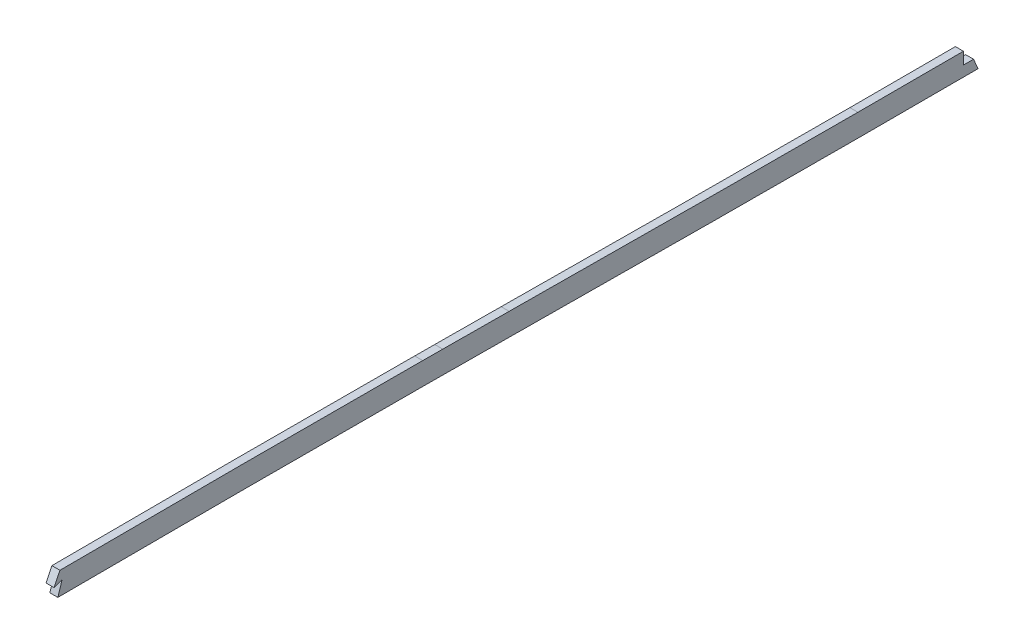
from build123d import *

# Parameters (mm, degrees)
BOSS_EXTRUDE1_START = -1.5875
BOSS_EXTRUDE1_DEPTH = 3.175
FILLET1_R           = 2.54
CUT_EXTRUDE1_DEPTH  = 2674.191025632
FILLET2_R           = 0.762
FILLET3_R           = 0.762
CUT_EXTRUDE2_DEPTH  = 7.62


with BuildPart() as part:
    # Boss-Extrude1: read off the stored shape, not the designer's step
    # Boss-Extrude1 outline → Boss-Extrude1 (new body)
    with BuildSketch(Plane(origin=(0, 0, 0), x_dir=(0, 0, -1), z_dir=(1, 0, 0)).offset(BOSS_EXTRUDE1_START)):
        with BuildLine():
            add(Edge.make_bspline(
                [(1110.404970926, 130.384545774), (1120.170834465, 130.370061323), (1139.703057908, 130.338772026), (1168.998370974, 130.277673039), (1198.290610395, 130.194386876), (1217.81419633, 130.113940836), (1227.576506903, 130.06508052)],
                knots=[0, 0, 0, 0, 0.25, 0.5, 0.75, 1, 1, 1, 1], degree=3))
            add(Edge.make_bspline(
                [(1227.576506903, 130.06508052), (1269.911205773, 129.853195249), (1333.427746701, 129.273373321), (1418.042208161, 127.449050563), (1502.665994832, 124.913583682), (1608.454176987, 120.803299479), (1693.070073331, 116.848243245), (1735.369787733, 114.744712179)],
                knots=[0, 0, 0, 0, 0.25, 0.375, 0.5, 0.75, 1, 1, 1, 1], degree=3))
            add(Edge.make_bspline(
                [(1735.369787733, 114.744712179), (1815.995940723, 110.735232018), (1936.906650462, 104.096364548), (2098.049485168, 94.18797875), (2198.694736725, 87.314638509), (2279.130413747, 81.114418931), (2339.412950304, 76.034076608), (2399.564054334, 70.28270545), (2479.570468264, 61.127378254), (2559.292087872, 49.650907614), (2626.797554585, 38.235484735), (2656.889518578, 32.788503969), (2667.159793662, 30.877771266), (2669.54, 30.432069924)],
                knots=[0, 0, 0, 0, 0.25, 0.375, 0.5, 0.5625, 0.625, 0.6875, 0.75, 0.875, 0.9375, 0.96241067, 0.969928536, 0.969928536, 0.969928536, 0.969928536], degree=3))
            Line((2669.54, 30.432069924), (2669.54, 39.476142465))
            add(Edge.make_bspline(
                [(1735.811334709, 123.623740069), (1776.138635499, 121.618292624), (1816.460281579, 119.500621806), (1897.093668675, 115.087561885), (1937.405638896, 112.792971084), (2018.018419045, 108.018366523), (2058.319512223, 105.539122976), (2138.903780144, 100.307240032), (2179.18739793, 97.555127955), (2239.586998714, 93.080168687), (2259.716280977, 91.529837622), (2289.900442602, 89.09084343), (2299.960179135, 88.258845039), (2320.076004566, 86.552861654), (2330.132100898, 85.678962223), (2350.239356518, 83.874334847), (2360.290489794, 82.943307484), (2380.385973971, 81.003183297), (2390.430065378, 79.993418555), (2420.547026195, 76.827577532), (2440.60648589, 74.533672955), (2480.675569568, 69.556278523), (2500.68715183, 66.874150811), (2540.654290207, 61.150246295), (2560.611026428, 58.109755646), (2600.475457131, 51.702465574), (2620.382967089, 48.337538888), (2650.028116889, 43.072156367), (2659.78844051, 41.29687683), (2669.54, 39.476142465)],
                knots=[0, 0, 0, 0, 0.125, 0.125, 0.25, 0.25, 0.375, 0.375, 0.5, 0.5, 0.5625, 0.5625, 0.59375, 0.59375, 0.625, 0.625, 0.65625, 0.65625, 0.6875, 0.6875, 0.75, 0.75, 0.8125, 0.8125, 0.875, 0.875, 0.9375, 0.9375, 0.968210768, 0.968210768, 0.968210768, 0.968210768], degree=3))
            add(Edge.make_bspline(
                [(1227.621000751, 138.954969175), (1248.807303679, 138.848931677), (1269.993583155, 138.701170252), (1312.363832348, 138.270664618), (1333.547719008, 137.987407832), (1375.912368189, 137.249274813), (1397.09309738, 136.7925677), (1439.451328259, 135.701855835), (1460.629010312, 135.069210584), (1502.979101161, 133.670541385), (1524.152152736, 132.907434339), (1566.494303759, 131.284732459), (1587.663166024, 130.423163385), (1651.164052809, 127.709123983), (1693.490421561, 125.728325331), (1735.811334709, 123.623740069)],
                knots=[0, 0, 0, 0, 0.125, 0.125, 0.25, 0.25, 0.375, 0.375, 0.5, 0.5, 0.625, 0.625, 0.75, 0.75, 1, 1, 1, 1], degree=3))
            add(Edge.make_bspline(
                [(1110.418156307, 139.274535996), (1129.952027249, 139.245563914), (1149.485893504, 139.211997476), (1188.553558893, 139.115899087), (1208.087346834, 139.052735015), (1227.621000751, 138.954969175)],
                knots=[0, 0, 0, 0, 0.5, 0.5, 1, 1, 1, 1], degree=3))
            add(Edge.make_bspline(
                [(768.740124165, 138.468408213), (782.976796045, 138.460280143), (797.213453801, 138.479500079), (825.686695051, 138.549690296), (839.923258916, 138.600062665), (868.396318956, 138.719026333), (882.632808962, 138.789607972), (911.105746117, 138.939594729), (925.342197007, 139.018479563), (953.81517223, 139.160090703), (968.051699178, 139.222241505), (996.524919377, 139.30995407), (1010.761605517, 139.335014039), (1039.234912871, 139.349647552), (1053.471562869, 139.340493535), (1081.944860968, 139.313691902), (1096.181508981, 139.29565137), (1110.418156307, 139.274535996)],
                knots=[0, 0, 0, 0, 0.125, 0.125, 0.25, 0.25, 0.375, 0.375, 0.5, 0.5, 0.625, 0.625, 0.75, 0.75, 0.875, 0.875, 1, 1, 1, 1], degree=3))
            add(Edge.make_bspline(
                [(630.778432202, 139.251437536), (653.771819614, 139.075315664), (676.765000849, 138.871740519), (711.255349111, 138.647690701), (722.752238945, 138.586174182), (745.746099074, 138.499784896), (757.243084259, 138.474972158), (768.740124165, 138.468408213)],
                knots=[0, 0, 0, 0, 0.5, 0.5, 0.75, 0.75, 1, 1, 1, 1], degree=3))
            add(Edge.make_bspline(
                [(604.514984259, 139.433685568), (609.940743136, 139.400696354), (618.695242427, 139.342071397), (627.449694696, 139.276935028), (630.778432202, 139.251437536)],
                knots=[0, 0, 0, 0, 0.619765686, 1, 1, 1, 1], degree=3))
            ThreePointArc((604.514984259, 139.433685568), (600.549356142, 139.457173081), (596.583720644, 139.479379304))
            add(Edge.make_bspline(
                [(436.133018826, 139.357176562), (449.50393779, 139.390650739), (462.874888934, 139.412366015), (489.61665939, 139.498555977), (502.987497127, 139.559076553), (529.729299233, 139.628029754), (543.100240501, 139.639230481), (569.84212102, 139.601013959), (583.212960696, 139.552035302), (596.583720644, 139.479379304)],
                knots=[0, 0, 0, 0, 0.25, 0.25, 0.5, 0.5, 0.75, 0.75, 1, 1, 1, 1], degree=3))
            add(Edge.make_bspline(
                [(432.263917423, 139.347117104), (433.553617637, 139.350567112), (434.843318039, 139.353947814), (436.133018826, 139.357176562)],
                knots=[0, 0, 0, 0, 1, 1, 1, 1], degree=3))
            add(Edge.make_bspline(
                [(420.316232014, 139.305761868), (422.413235913, 139.315186344), (426.395793967, 139.330351666), (430.378363115, 139.342073082), (432.263917423, 139.347117104)],
                knots=[0, 0, 0, 0, 0.526548575, 1, 1, 1, 1], degree=3))
            add(Edge.make_bspline(
                [(376.410119779, 138.75403864), (383.726317086, 138.935561778), (391.043801196, 139.055611797), (405.679602634, 139.224192856), (412.997895507, 139.272871444), (420.316232014, 139.305761868)],
                knots=[0, 0, 0, 0, 0.5, 0.5, 1, 1, 1, 1], degree=3))
            add(Edge.make_bspline(
                [(336.49221538, 137.002990798), (349.782924989, 137.88646357), (363.094318653, 138.423658969), (376.410119779, 138.75403864)],
                knots=[0, 0, 0, 0, 1, 1, 1, 1], degree=3))
            add(Edge.make_bspline(
                [(322.369488076, 135.928469458), (327.073374868, 136.333386449), (331.781331813, 136.689844531), (336.49221538, 137.002990798)],
                knots=[0, 0, 0, 0, 1, 1, 1, 1], degree=3))
            add(Edge.make_bspline(
                [(269.769949315, 129.47895505), (274.123387467, 130.231879276), (278.485668028, 130.925946417), (287.22796256, 132.196043087), (291.608626646, 132.771988738), (300.381777496, 133.818422146), (304.774579419, 134.288963443), (313.567800313, 135.154375086), (317.967903853, 135.549407043), (322.369488076, 135.928469458)],
                knots=[0, 0, 0, 0, 0.25, 0.25, 0.5, 0.5, 0.75, 0.75, 1, 1, 1, 1], degree=3))
            add(Edge.make_bspline(
                [(135.15718457, 90.054634926), (146.043739673, 94.375230064), (156.99891695, 98.504335222), (173.56622243, 104.322560697), (179.110932848, 106.199810145), (190.24859245, 109.819698901), (195.841545849, 111.562316625), (207.065472514, 114.901345648), (212.697969124, 116.49836249), (224.005973618, 119.540534541), (229.683240596, 120.9862349), (246.767187276, 125.077694043), (258.225188059, 127.482295924), (269.769949315, 129.47895505)],
                knots=[0, 0, 0, 0, 0.25, 0.25, 0.375, 0.375, 0.5, 0.5, 0.625, 0.625, 0.75, 0.75, 1, 1, 1, 1], degree=3))
            add(Edge.make_bspline(
                [(107.049744533, 78.466050261), (116.373258882, 82.438606419), (125.737350123, 86.316143859), (135.15718457, 90.054634926)],
                knots=[0, 0, 0, 0, 1, 1, 1, 1], degree=3))
            add(Edge.make_bspline(
                [(99.06, 75.03568963), (99.223542669, 75.106424562), (100.635498802, 75.716852689), (103.297453866, 76.863328103), (105.798503999, 77.932922637), (107.049744533, 78.466050261)],
                knots=[0.484151133, 0.484151133, 0.484151133, 0.484151133, 0.515864471, 0.757931449, 1, 1, 1, 1], degree=3))
            Line((99.06, 75.03568963), (99.06, 65.345043949))
            add(Edge.make_bspline(
                [(99.06, 65.345043949), (99.380370965, 65.484464523), (100.637671455, 66.031176319), (103.17753745, 67.132002814), (106.681577323, 68.64166857), (109.249580285, 69.740028797), (110.534459652, 70.287489229)],
                knots=[0.254738807, 0.254738807, 0.254738807, 0.254738807, 0.317238807, 0.5, 0.75, 1, 1, 1, 1], degree=3))
            add(Edge.make_bspline(
                [(110.534459652, 70.287489229), (112.850658013, 71.274373329), (117.489277519, 73.236837099), (124.456688526, 76.138068453), (131.438476528, 78.994265342), (136.101204469, 80.864754132), (138.436571012, 81.791601309)],
                knots=[0, 0, 0, 0, 0.25, 0.5, 0.75, 1, 1, 1, 1], degree=3))
            add(Edge.make_bspline(
                [(138.436571012, 81.791601309), (143.826897197, 83.930883835), (154.6522834, 88.11877139), (176.408203186, 96.037596764), (203.906835742, 104.998187521), (237.39469787, 114.027149543), (259.934818065, 118.755998441), (271.284977744, 120.719001348)],
                knots=[0, 0, 0, 0, 0.125, 0.25, 0.5, 0.75, 1, 1, 1, 1], degree=3))
            add(Edge.make_bspline(
                [(271.284977744, 120.719001348), (275.558711595, 121.458140765), (284.124297478, 122.821139095), (297.036360548, 124.518896272), (310.018420247, 125.909880891), (318.766623126, 126.695286194), (323.13209925, 127.071239405)],
                knots=[5e-09, 5e-09, 5e-09, 5e-09, 0.2499992, 0.4999984, 0.7499976, 0.999996801, 0.999996801, 0.999996801, 0.999996801], degree=3))
            add(Edge.make_bspline(
                [(323.13209925, 127.071239405), (324.293050056, 127.171175344), (326.615168427, 127.365043892), (330.101568176, 127.638529754), (333.590184216, 127.895089457), (335.917953069, 128.055198639), (337.081858513, 128.132566852)],
                knots=[1.2024e-05, 1.2024e-05, 1.2024e-05, 1.2024e-05, 0.250009018, 0.500006012, 0.750003006, 1, 1, 1, 1], degree=3))
            add(Edge.make_bspline(
                [(337.081858513, 128.132566852), (340.367862287, 128.350997241), (346.939906877, 128.744909116), (356.821319657, 129.221190111), (366.716250393, 129.595096292), (373.326613137, 129.784797569), (376.630622597, 129.866773678)],
                knots=[0, 0, 0, 0, 0.25, 0.5, 0.75, 1, 1, 1, 1], degree=3))
            add(Edge.make_bspline(
                [(376.630622597, 129.866773678), (380.266394474, 129.956981294), (387.534764147, 130.106779908), (398.462206547, 130.259361028), (409.400972015, 130.358727994), (416.705417778, 130.39944419), (420.356185481, 130.415851648)],
                knots=[0, 0, 0, 0, 0.25, 0.5, 0.75, 1, 1, 1, 1], degree=3))
            add(Edge.make_bspline(
                [(420.356185481, 130.415851648), (421.350045129, 130.420318309), (423.337533562, 130.428603137), (426.320174328, 130.439402209), (429.303468332, 130.448883952), (431.293011648, 130.454488038), (432.287698861, 130.457148912)],
                knots=[0, 0, 0, 0, 0.25, 0.5, 0.75, 1, 1, 1, 1], degree=3))
            add(Edge.make_bspline(
                [(432.287698861, 130.457148912), (432.610032304, 130.45801117), (433.254717136, 130.45972707), (434.221637716, 130.462266911), (435.188505114, 130.464765142), (435.833012253, 130.466397641), (436.155274747, 130.46720442)],
                knots=[9.2e-08, 9.2e-08, 9.2e-08, 9.2e-08, 0.25, 0.5, 0.75, 1, 1, 1, 1], degree=3))
            add(Edge.make_bspline(
                [(436.155274747, 130.46720442), (449.528322363, 130.500683927), (476.275740382, 130.546633815), (516.38896029, 130.728798697), (556.456290895, 130.759667498), (583.176533448, 130.662101975), (596.535396133, 130.589510646)],
                knots=[0, 0, 0, 0, 0.249999973, 0.499999946, 0.749999918, 0.999999891, 0.999999891, 0.999999891, 0.999999891], degree=3))
            ThreePointArc((596.535396133, 130.589510646), (600.498158983, 130.567320504), (604.460914457, 130.543849998))
            add(Edge.make_bspline(
                [(604.460914457, 130.543849998), (606.648150431, 130.530551362), (611.022503017, 130.502867011), (617.584689429, 130.458405465), (624.147187284, 130.411339888), (628.522663802, 130.378455494), (630.7103385, 130.361698324)],
                knots=[-7.09e-07, -7.09e-07, -7.09e-07, -7.09e-07, 0.249999468, 0.499999646, 0.749999823, 1, 1, 1, 1], degree=3))
            add(Edge.make_bspline(
                [(630.7103385, 130.361698324), (642.206126489, 130.273644326), (665.193556095, 130.083785311), (699.699077953, 129.819212193), (734.21504011, 129.634735151), (757.228597075, 129.58497898), (768.735048644, 129.578409662)],
                knots=[0, 0, 0, 0, 0.25, 0.5, 0.75, 1, 1, 1, 1], degree=3))
            add(Edge.make_bspline(
                [(768.735048644, 129.578409662), (797.222409768, 129.56214552), (854.203652026, 129.725124503), (939.635195481, 130.236578518), (1024.992958464, 130.524931921), (1081.937612336, 130.426767717), (1110.404970926, 130.384545774)],
                knots=[0, 0, 0, 0, 0.25, 0.5, 0.75, 1, 1, 1, 1], degree=3))
        make_face()
    extrude(amount=BOSS_EXTRUDE1_DEPTH)

    # Fillet1
    fillet1_edges = [part.edges().sort_by_distance(p)[0] for p in [
        (0, 39.476142465, -2669.54),
        (0, 30.432069924, -2669.54),
        (0, 65.345043949, -99.06),
        (0, 75.03568963, -99.06),
    ]]
    fillet(fillet1_edges, radius=FILLET1_R)

    # Sketch4 → Cut-Extrude1 (cut, through all)
    with BuildSketch(Plane(origin=(1.5875, 0, 0), x_dir=(0, 0, -1), z_dir=(1, 0, 0))):
        Polygon((1827.2125, 118.895836595), (1827.2125, 110.000384115), (1827.2125, 78.791710134), (2135.1875, 78.791710134), (2135.1875, 91.599357392), (2135.1875, 100.508307819), (2135.1875, 129.353842083), (1827.2125, 129.353842083), align=None)
    extrude(amount=-CUT_EXTRUDE1_DEPTH, mode=Mode.SUBTRACT)


with BuildPart() as cut_extrude1_piece_1:
    # of the separate pieces the step leaves, piece 1, a body of its own (cut_extrude1_pieces)
    add(part.part.solids().sort_by_distance((-1.5875, 114.744712179, -1735.369787733))[0])

    # Fillet2
    fillet2_edges = [cut_extrude1_piece_1.edges().sort_by_distance(p)[0] for p in [
        (0, 118.895836595, -1827.2125),
        (0, 110.000384116, -1827.2125),
    ]]
    fillet(fillet2_edges, radius=FILLET2_R)


with BuildPart() as cut_extrude1_piece_2:
    # of the separate pieces the step leaves, piece 2, a body of its own (cut_extrude1_pieces)
    add(part.part.solids().sort_by_distance((-1.5875, 91.599357392, -2135.1875))[0])

    # Fillet3
    fillet3_edges = [cut_extrude1_piece_2.edges().sort_by_distance(p)[0] for p in [
        (0, 100.508307819, -2135.1875),
        (0, 91.599357392, -2135.1875),
    ]]
    fillet(fillet3_edges, radius=FILLET3_R)


with BuildPart() as cut_extrude2_tool:
    # Sketch5 → Cut-Extrude2 (new body)
    with BuildSketch(Plane(origin=(1.5875, 0, 0), x_dir=(0, 0, -1), z_dir=(1, 0, 0))):
        Polygon((453.088349995, 139.395824167), (450.752036301, 134.613422753), (453.975418286, 135.844351639), (452.268768997, 130.504363999), (452.268768997, 127.575945218), (73.329869983, 29.953173686), (0, 149.408643021), (453.088349995, 149.408643021), align=None)
        Polygon((810.468029574, 138.512199639), (810.468029574, 133.759282778), (814.491468237, 133.759282778), (816.238424635, 129.632745348), (816.238424635, 125.564439067), (2630.646632523, -161.702489223), (2897.593300558, 152.988782274), (810.468029574, 152.988782274), align=None)
    extrude(amount=-CUT_EXTRUDE2_DEPTH)


with BuildPart() as cut_extrude1_piece_1_1:
    add(cut_extrude1_piece_1.part)

    # Cut-Extrude2: cut by cut_extrude2_tool
    add(cut_extrude2_tool.part, mode=Mode.SUBTRACT)


with BuildPart() as cut_extrude1_piece_2_1:
    add(cut_extrude1_piece_2.part)

    # Cut-Extrude2: cut by cut_extrude2_tool
    add(cut_extrude2_tool.part, mode=Mode.SUBTRACT)


solid = cut_extrude1_piece_1_1.part
